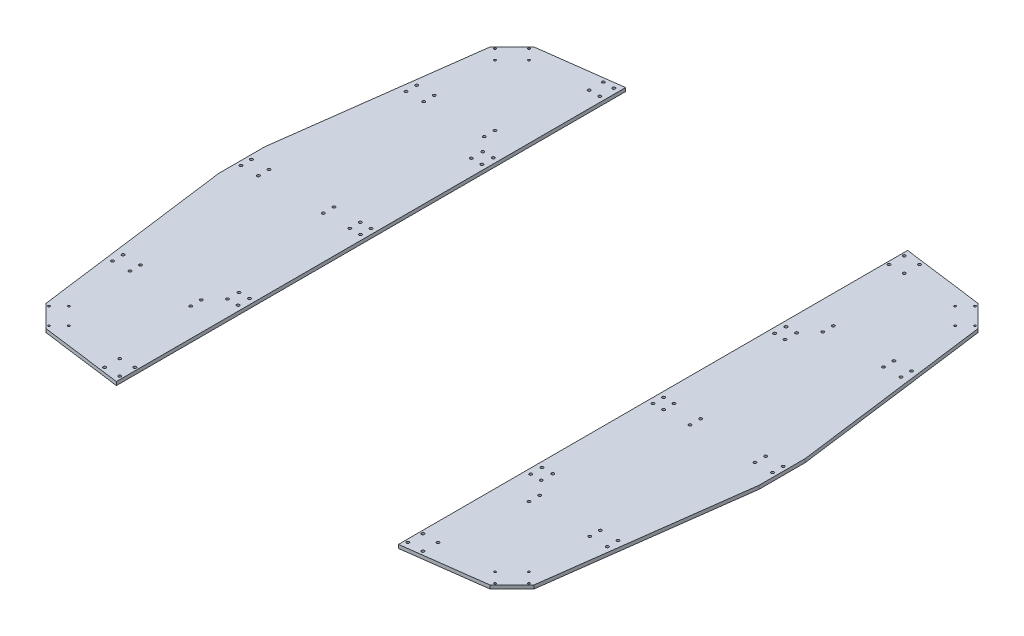
from build123d import *

# Parameters (mm, degrees)
SKETCH_1_R               = 1.5
SKETCH_1_R_2             = 2.000000001
SKETCH_1_R_3             = 2
SKETCH_1_R_4             = 2.000000003
SKETCH_1_R_5             = 1.999999999
SKETCH_1_R_6             = 250
EXTRUDE_2_DEPTH          = 5
CUT_EXTRUDE_1_DEPTH      = 542.772616539
CUT_EXTRUDE_1_DEPTH_BACK = 122
CUT_EXTRUDE_2_DEPTH      = 527.431195247
CUT_EXTRUDE_2_DEPTH_BACK = 39
SKETCH_3_R               = 2
CUT_EXTRUDE_3_DEPTH      = 20
CUT_EXTRUDE_3_DEPTH_BACK = 527.431195247
SKETCH_4_R               = 2
SKETCH_5_R               = 2
EXTRUDE_3_DEPTH          = 5


with BuildPart() as part:
    # 草图1 → 凸台-拉伸2 (new body)
    with BuildSketch(Plane(origin=(0, 0, 0), x_dir=(1, 0, 0), z_dir=(0, 1, 0))):
        Polygon((-32.720120418, 383.074776011), (-314.922171201, 345.922171201), (-345.922171201, 314.922171201), (-383.074776011, 32.720120418), (-383.074776011, -32.720120418), (-345.922171201, -314.922171201), (-314.922171201, -345.922171201), (-32.720120418, -383.074776011), (32.720120418, -383.074776011), (314.922171201, -345.922171201), (345.922171201, -314.922171201), (383.074776011, -32.720120418), (383.074776011, 32.720120418), (345.922171201, 314.922171201), (314.922171201, 345.922171201), (32.720120418, 383.074776011), (0, 383.074776011), align=None)
        with Locations((-316.280035574, -340.321666135)):
            Circle(SKETCH_1_R, mode=Mode.SUBTRACT)
        with Locations((-340.321666134, -316.280035574)):
            Circle(SKETCH_1_R, mode=Mode.SUBTRACT)
        with Locations((-302.137899951, -326.179530511)):
            Circle(SKETCH_1_R, mode=Mode.SUBTRACT)
        with Locations((-326.179530511, -302.137899951)):
            Circle(SKETCH_1_R, mode=Mode.SUBTRACT)
        with Locations((-350.918362047, -215.681953428)):
            Circle(SKETCH_1_R_2, mode=Mode.SUBTRACT)
        with Locations((-350.918362047, -200.681953428)):
            Circle(SKETCH_1_R_2, mode=Mode.SUBTRACT)
        with Locations((-325.918362047, -215.681953428)):
            Circle(SKETCH_1_R_2, mode=Mode.SUBTRACT)
        with Locations((-325.918362047, -200.681953428)):
            Circle(SKETCH_1_R_2, mode=Mode.SUBTRACT)
        with Locations((-240, -215.681953429)):
            Circle(SKETCH_1_R_3, mode=Mode.SUBTRACT)
        with Locations((-240, -200.681953429)):
            Circle(SKETCH_1_R_3, mode=Mode.SUBTRACT)
        with Locations((-222.5, -181.030079822)):
            Circle(SKETCH_1_R_3, mode=Mode.SUBTRACT)
        with Locations((-207.5, -181.030079822)):
            Circle(SKETCH_1_R_3, mode=Mode.SUBTRACT)
        with Locations((-222.5, -164.825516547)):
            Circle(SKETCH_1_R_3, mode=Mode.SUBTRACT)
        with Locations((-207.5, -164.825516547)):
            Circle(SKETCH_1_R_3, mode=Mode.SUBTRACT)
        with Locations((-377.074776011, -7.499878938)):
            Circle(SKETCH_1_R_3, mode=Mode.SUBTRACT)
        with Locations((-352.074776011, -7.499878938)):
            Circle(SKETCH_1_R_3, mode=Mode.SUBTRACT)
        with Locations((-260, -7.5)):
            Circle(SKETCH_1_R_3, mode=Mode.SUBTRACT)
        with Locations((316.280035574, -340.321666135)):
            Circle(SKETCH_1_R, mode=Mode.SUBTRACT)
        with Locations((302.13789995, -326.179530511)):
            Circle(SKETCH_1_R, mode=Mode.SUBTRACT)
        with Locations((326.179530511, -302.137899951)):
            Circle(SKETCH_1_R, mode=Mode.SUBTRACT)
        with Locations((340.321666135, -316.280035574)):
            Circle(SKETCH_1_R, mode=Mode.SUBTRACT)
        with Locations((240, -215.681953429)):
            Circle(SKETCH_1_R_3, mode=Mode.SUBTRACT)
        with Locations((240, -200.681953429)):
            Circle(SKETCH_1_R_3, mode=Mode.SUBTRACT)
        with Locations((325.918362046, -215.681953435)):
            Circle(SKETCH_1_R_4, mode=Mode.SUBTRACT)
        with Locations((325.918362046, -200.681953435)):
            Circle(SKETCH_1_R_4, mode=Mode.SUBTRACT)
        with Locations((350.918362046, -215.681953435)):
            Circle(SKETCH_1_R_4, mode=Mode.SUBTRACT)
        with Locations((350.918362046, -200.681953435)):
            Circle(SKETCH_1_R_4, mode=Mode.SUBTRACT)
        with Locations((207.5, -181.030079822)):
            Circle(SKETCH_1_R_3, mode=Mode.SUBTRACT)
        with Locations((222.5, -181.030079822)):
            Circle(SKETCH_1_R_3, mode=Mode.SUBTRACT)
        with Locations((207.5, -164.825516547)):
            Circle(SKETCH_1_R_3, mode=Mode.SUBTRACT)
        with Locations((222.5, -164.825516547)):
            Circle(SKETCH_1_R_3, mode=Mode.SUBTRACT)
        with Locations((260, -7.5)):
            Circle(SKETCH_1_R_3, mode=Mode.SUBTRACT)
        with Locations((352.074776011, -7.595099646)):
            Circle(SKETCH_1_R_3, mode=Mode.SUBTRACT)
        with Locations((377.074776011, -7.595099646)):
            Circle(SKETCH_1_R_3, mode=Mode.SUBTRACT)
        with Locations((-377.074776011, 7.500121062)):
            Circle(SKETCH_1_R_3, mode=Mode.SUBTRACT)
        with Locations((-352.074776011, 7.500121062)):
            Circle(SKETCH_1_R_3, mode=Mode.SUBTRACT)
        with Locations((-260, 7.5)):
            Circle(SKETCH_1_R_3, mode=Mode.SUBTRACT)
        with Locations((-222.5, 164.825516547)):
            Circle(SKETCH_1_R_3, mode=Mode.SUBTRACT)
        with Locations((-207.5, 164.825516547)):
            Circle(SKETCH_1_R_3, mode=Mode.SUBTRACT)
        with Locations((-222.5, 181.030079822)):
            Circle(SKETCH_1_R_3, mode=Mode.SUBTRACT)
        with Locations((-207.5, 181.030079822)):
            Circle(SKETCH_1_R_3, mode=Mode.SUBTRACT)
        with Locations((-350.918362047, 200.681953428)):
            Circle(SKETCH_1_R_5, mode=Mode.SUBTRACT)
        with Locations((-350.918362047, 215.681953428)):
            Circle(SKETCH_1_R_5, mode=Mode.SUBTRACT)
        with Locations((-325.918362047, 200.681953428)):
            Circle(SKETCH_1_R_5, mode=Mode.SUBTRACT)
        with Locations((-325.918362047, 215.681953428)):
            Circle(SKETCH_1_R_5, mode=Mode.SUBTRACT)
        with Locations((-240, 200.681953428)):
            Circle(SKETCH_1_R_3, mode=Mode.SUBTRACT)
        with Locations((-240, 215.681953428)):
            Circle(SKETCH_1_R_3, mode=Mode.SUBTRACT)
        with Locations((-340.321666134, 316.280035574)):
            Circle(SKETCH_1_R, mode=Mode.SUBTRACT)
        with Locations((-326.179530511, 302.137899951)):
            Circle(SKETCH_1_R, mode=Mode.SUBTRACT)
        with Locations((-302.13789995, 326.179530511)):
            Circle(SKETCH_1_R, mode=Mode.SUBTRACT)
        with Locations((-316.280035574, 340.321666134)):
            Circle(SKETCH_1_R, mode=Mode.SUBTRACT)
        Circle(SKETCH_1_R_6, mode=Mode.SUBTRACT)
        with Locations((260, 7.5)):
            Circle(SKETCH_1_R_3, mode=Mode.SUBTRACT)
        with Locations((352.074776011, 7.500121062)):
            Circle(SKETCH_1_R_3, mode=Mode.SUBTRACT)
        with Locations((377.074776011, 7.500121062)):
            Circle(SKETCH_1_R_3, mode=Mode.SUBTRACT)
        with Locations((207.5, 164.825516547)):
            Circle(SKETCH_1_R_3, mode=Mode.SUBTRACT)
        with Locations((222.5, 164.825516547)):
            Circle(SKETCH_1_R_3, mode=Mode.SUBTRACT)
        with Locations((207.5, 181.030079822)):
            Circle(SKETCH_1_R_3, mode=Mode.SUBTRACT)
        with Locations((222.5, 181.030079822)):
            Circle(SKETCH_1_R_3, mode=Mode.SUBTRACT)
        with Locations((240, 200.681953428)):
            Circle(SKETCH_1_R_3, mode=Mode.SUBTRACT)
        with Locations((240, 215.681953428)):
            Circle(SKETCH_1_R_3, mode=Mode.SUBTRACT)
        with Locations((325.918362046, 200.681953435)):
            Circle(SKETCH_1_R_5, mode=Mode.SUBTRACT)
        with Locations((325.918362046, 215.681953435)):
            Circle(SKETCH_1_R_5, mode=Mode.SUBTRACT)
        with Locations((350.918362046, 200.681953435)):
            Circle(SKETCH_1_R_5, mode=Mode.SUBTRACT)
        with Locations((350.918362046, 215.681953435)):
            Circle(SKETCH_1_R_5, mode=Mode.SUBTRACT)
        with Locations((326.179530511, 302.13789995)):
            Circle(SKETCH_1_R, mode=Mode.SUBTRACT)
        with Locations((302.137899951, 326.179530511)):
            Circle(SKETCH_1_R, mode=Mode.SUBTRACT)
        with Locations((340.321666135, 316.280035574)):
            Circle(SKETCH_1_R, mode=Mode.SUBTRACT)
        with Locations((316.280035574, 340.321666134)):
            Circle(SKETCH_1_R, mode=Mode.SUBTRACT)
    extrude(amount=EXTRUDE_2_DEPTH)

    # 草图2 → 切除-拉伸1 (cut, two sides: drawn at the far end of the back side and taken through both)
    with BuildSketch(Plane(origin=(0, 5, 0), x_dir=(1, 0, 0), z_dir=(0, 1, 0)).offset(-CUT_EXTRUDE_1_DEPTH_BACK)):
        Polygon((-200, 484.714921051), (-200, 361.051962068), (-200, -361.051962068), (-200, -418.819036359), (200, -418.819036359), (200, -361.051962068), (200, 361.051962068), (200, 484.714921051), align=None)
    extrude(amount=CUT_EXTRUDE_1_DEPTH + CUT_EXTRUDE_1_DEPTH_BACK, mode=Mode.SUBTRACT)


with BuildPart() as cut_extrude_1_piece_1:
    # of the separate pieces the step leaves, piece 1, a body of its own (cut_extrude_1_pieces)
    add(part.part.solids().sort_by_distance((-314.922171201, 0, 345.922171201))[0])

    # 草图3 → 切除-拉伸2 (cut, two sides: drawn at the far end of the back side and taken through both)
    with BuildSketch(Plane(origin=(0, 0, 0), x_dir=(-1, 0, 0), z_dir=(0, -1, 0)).offset(-CUT_EXTRUDE_2_DEPTH_BACK)):
        with Locations((225.752728605, -352.02249242)):
            Circle(SKETCH_3_R)
        with Locations((204.247271395, -352.02249242)):
            Circle(SKETCH_3_R)
        with Locations((225.752728605, -330.517035211)):
            Circle(SKETCH_3_R)
        with Locations((204.247271395, -330.517035211)):
            Circle(SKETCH_3_R)
    extrude(amount=CUT_EXTRUDE_2_DEPTH + CUT_EXTRUDE_2_DEPTH_BACK, mode=Mode.SUBTRACT)


with BuildPart() as cut_extrude_1_piece_2:
    # of the separate pieces the step leaves, piece 2, a body of its own (cut_extrude_1_pieces)
    add(part.part.solids().sort_by_distance((200, 0, 361.051962068))[0])


with BuildPart() as cut_extrude_3_tool:
    # 草图4 → 切除-拉伸3 (new, two sides: drawn at the far end of the back side and taken through both)
    with BuildSketch(Plane(origin=(0, 5, 0), x_dir=(1, 0, 0), z_dir=(0, 1, 0)).offset(-CUT_EXTRUDE_3_DEPTH_BACK)):
        with Locations((-207.5, 352.018568286)):
            Circle(SKETCH_4_R)
        with Locations((-222.5, 352.018568286)):
            Circle(SKETCH_4_R)
        with Locations((-222.5, 332.018568286)):
            Circle(SKETCH_4_R)
        with Locations((-207.5, 332.018568286)):
            Circle(SKETCH_4_R)
        with Locations((204.247271395, 330.513111077)):
            Circle(SKETCH_4_R)
        with Locations((225.752728605, 330.513111077)):
            Circle(SKETCH_4_R)
        with Locations((204.247271395, 352.018568286)):
            Circle(SKETCH_4_R)
        with Locations((225.752728605, 352.018568286)):
            Circle(SKETCH_4_R)
        with Locations((204.247271395, -352.02249242)):
            Circle(SKETCH_4_R)
        with Locations((225.752728605, -352.02249242)):
            Circle(SKETCH_4_R)
        with Locations((204.247271395, -330.517035211)):
            Circle(SKETCH_4_R)
        with Locations((225.752728605, -330.517035211)):
            Circle(SKETCH_4_R)
    extrude(amount=CUT_EXTRUDE_3_DEPTH + CUT_EXTRUDE_3_DEPTH_BACK)


with BuildPart() as cut_extrude_1_piece_1_1:
    add(cut_extrude_1_piece_1.part)

    # 切除-拉伸3: cut by cut_extrude_3_tool
    add(cut_extrude_3_tool.part, mode=Mode.SUBTRACT)



with BuildPart() as cut_extrude_1_piece_2_1:
    add(cut_extrude_1_piece_2.part)

    # 切除-拉伸3: cut by cut_extrude_3_tool
    add(cut_extrude_3_tool.part, mode=Mode.SUBTRACT)


with BuildPart() as cut_extrude_1_piece_1_2:
    add(cut_extrude_1_piece_1_1.part)

    add(cut_extrude_1_piece_2_1.part)  # 凸台-拉伸3 merges 切除-拉伸1 piece 2
    # 草图5 → 凸台-拉伸3 (add)
    # profile 1 of 2: a face of its own
    with BuildSketch(Plane(origin=(0, 5, 0), x_dir=(1, 0, 0), z_dir=(0, 1, 0))):
        with BuildLine():
            Line((-200, -150), (-200, 150))
            ThreePointArc((-200, 150), (-250, 0), (-200, -150))
        make_face()
        with Locations((-222.5, -7.5)):
            Circle(SKETCH_5_R, mode=Mode.SUBTRACT)
        with Locations((-207.5, -7.5)):
            Circle(SKETCH_5_R, mode=Mode.SUBTRACT)
        with Locations((-222.5, 7.5)):
            Circle(SKETCH_5_R, mode=Mode.SUBTRACT)
        with Locations((-207.5, 7.5)):
            Circle(SKETCH_5_R, mode=Mode.SUBTRACT)
    # profile 2 of 2: a face of its own
    with BuildSketch(Plane(origin=(0, 5, 0), x_dir=(1, 0, 0), z_dir=(0, 1, 0))):
        with BuildLine():
            ThreePointArc((200, -150), (250, 0), (200, 150))
            Line((200, 150), (200, -150))
        make_face()
        with Locations((207.5, -7.5)):
            Circle(SKETCH_5_R, mode=Mode.SUBTRACT)
        with Locations((222.5, -7.5)):
            Circle(SKETCH_5_R, mode=Mode.SUBTRACT)
        with Locations((207.5, 7.5)):
            Circle(SKETCH_5_R, mode=Mode.SUBTRACT)
        with Locations((222.5, 7.5)):
            Circle(SKETCH_5_R, mode=Mode.SUBTRACT)
    extrude(amount=-EXTRUDE_3_DEPTH)


solid = cut_extrude_1_piece_1_2.part
